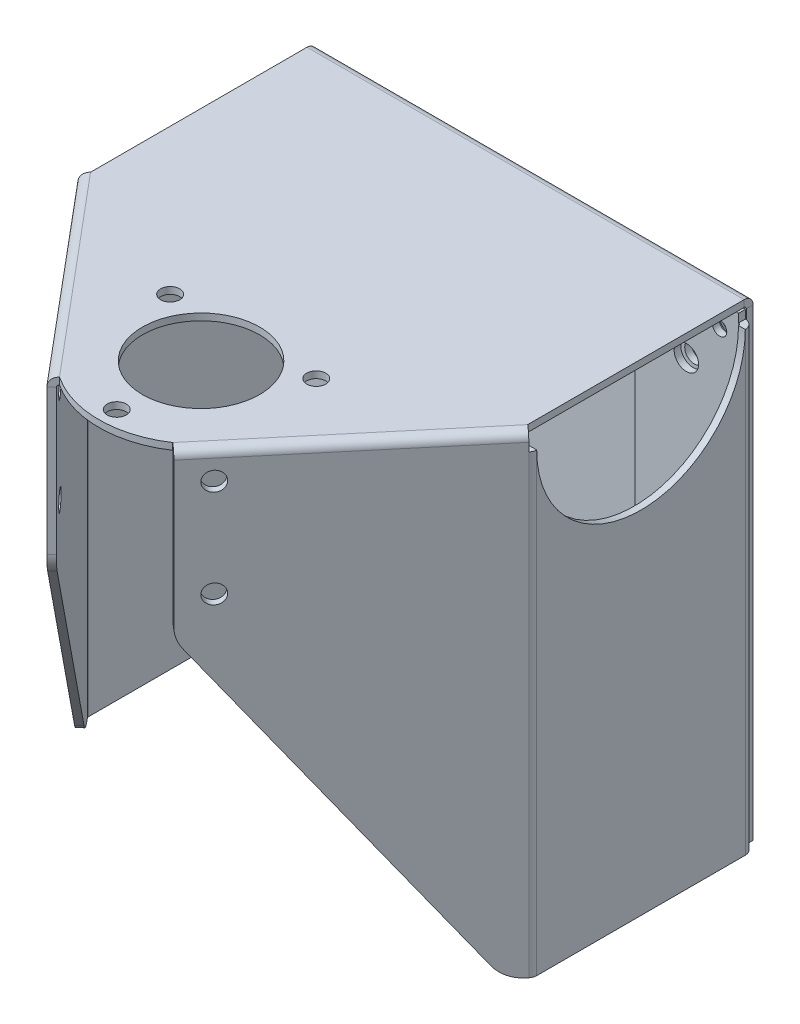
from build123d import *

# Parameters (mm, degrees)
SKETCH1_W                       = 98.5
SKETCH1_H                       = 105
BASE_FLANGE1_DEPTH              = 1.524
EDGE_FLANGE11_STRIP_W           = 7.096
EDGE_FLANGE11_STRIP_H           = 1.524
EDGE_FLANGE11_STRIP_CUT_DEPTH   = 98.5
EDGE_FLANGE11_DEPTH             = 98.5
CUT_EXTRUDE5_DEPTH              = 126.105066452
CUT_EXTRUDE5_DEPTH_BACK         = 126.105066452
SKETCH21_OUTSIDE_W              = 135.916
SKETCH21_OUTSIDE_H              = 138.94
EDGE_FLANGE12_DEPTH             = 56.768812786
EDGE_FLANGE12_BEND_DEPTH        = 56.768812786
EDGE_FLANGE13_DEPTH             = 104.5
EDGE_FLANGE13_BEND_DEPTH        = 104.5
EDGE_FLANGE14_STRIP_W           = 7.346
EDGE_FLANGE14_STRIP_H           = 1.524
EDGE_FLANGE14_STRIP_CUT_DEPTH   = 104.5
EDGE_FLANGE14_STRIP_2_W         = 7.346
EDGE_FLANGE14_STRIP_2_H         = 1.524
EDGE_FLANGE14_STRIP_CUT_2_DEPTH = 104.5
EDGE_FLANGE14_DEPTH             = 104.5
EDGE_FLANGE14_BEND_DEPTH        = 104.5
M4_CLEARANCE_HOLE4_D            = 5.5
M4_CLEARANCE_HOLE4_DEPTH        = 1.773
M4_CLEARANCE_HOLE7_REACH        = 125.212
M4_CLEARANCE_HOLE7_BORE_R       = 2.15
SKETCH54_R                      = 13.2
CUT_EXTRUDE3_DEPTH              = 154.655695253
UNFOLD1_START                   = -52.5
UNFOLD1_DEPTH                   = 104.5
UNFOLD1_2_DEPTH                 = 104.5
UNFOLD1_START_2                 = 70
UNFOLD1_3_OUTLINE_R             = 2.75
UNFOLD1_3_OUTLINE_R_2           = 1.6
UNFOLD1_3_DEPTH                 = 3
CUT_EXTRUDE8_REACH              = 132.29
UNFOLD2_START                   = -52.5
UNFOLD2_DEPTH                   = 104.5
UNFOLD2_2_DEPTH                 = 104.5
UNFOLD2_START_2                 = -73
UNFOLD2_3_OUTLINE_R             = 2.75
UNFOLD2_3_OUTLINE_R_2           = 1.6
UNFOLD2_3_DEPTH                 = 3
CUT_EXTRUDE9_REACH              = 172.578
FOLD8_START                     = 50.619283571
FOLD8_OUTLINE_W                 = 1.524
FOLD8_OUTLINE_H                 = 102.601
FOLD8_DEPTH                     = 1.481718551
FOLD8_START_2                   = 50.446476318
FOLD8_2_OUTLINE_W               = 1.524
FOLD8_2_OUTLINE_H               = 102.601
FOLD8_2_DEPTH                   = 0.353523682
FOLD8_START_3                   = -52.5
FOLD8_3_DEPTH                   = 104.5
FOLD8_START_4                   = 48.6000001
FOLD8_4_DEPTH                   = 1.5009999
FOLD8_5_DEPTH                   = 102.601
FOLD8_START_5                   = 50.101
FOLD8_6_OUTLINE_W               = 23.376
FOLD8_6_OUTLINE_H               = 1.524
FOLD8_6_DEPTH                   = 1.899
FOLD8_START_6                   = 40.12202674
FOLD8_7_DEPTH                   = 8.47797336
M4_CLEARANCE_HOLE5_D            = 4.3
M4_CLEARANCE_HOLE5_DEPTH        = 29.478592313
FILLET2_R                       = 7
M4_CLEARANCE_HOLE6_D            = 4.3


with BuildPart() as part:
    # Base-Flange1: sheet metal written as solids
    # Sketch1 → Base-Flange1 (new body)
    with BuildSketch(Plane.XY):
        Rectangle(SKETCH1_W, SKETCH1_H)
    extrude(amount=BASE_FLANGE1_DEPTH)

    # Edge-Flange11: sheet metal written as solids
    # Edge-Flange11 strip (on a plane across the edge) → Edge-Flange11 strip cut (cut)
    with BuildSketch(Plane(origin=(49.25, 52.5, 1.524), x_dir=(0, -1, 0), z_dir=(-1, 0, 0))):
        with Locations((-3.048, -0.762)):
            Rectangle(EDGE_FLANGE11_STRIP_W, EDGE_FLANGE11_STRIP_H)
    extrude(amount=EDGE_FLANGE11_STRIP_CUT_DEPTH, mode=Mode.SUBTRACT)

    # Edge-Flange11 section (on a plane across the edge) → Edge-Flange11 (add)
    with BuildSketch(Plane(origin=(49.25, 52.5, 1.524), x_dir=(0, -1, 0), z_dir=(-1, 0, 0))):
        with BuildLine():
            Line((-1.524, 0.5), (-1.524, 100))
            Line((-1.524, 100), (0, 100))
            Line((0, 100), (0, 0.5))
            ThreePointArc((0, 0.5), (0.146446609, 0.146446609), (0.5, 0))
            Line((0.5, 0), (0.5, -1.524))
            ThreePointArc((0.5, -1.524), (-0.931184125, -0.931184125), (-1.524, 0.5))
        make_face()
    extrude(amount=EDGE_FLANGE11_DEPTH)

    # Sketch21 outside → Cut-Extrude5 (cut, two sides: drawn at the far end of the back side and taken through both)
    with BuildSketch(Plane(origin=(0, 0, 0), x_dir=(1, 0, 0), z_dir=(0, 1, 0)).offset(-CUT_EXTRUDE5_DEPTH_BACK)):
        with Locations((0, -50.762)):
            Rectangle(SKETCH21_OUTSIDE_W, SKETCH21_OUTSIDE_H)
        with BuildLine():
            Line((49.25, 0), (0, 0))
            Line((0, 0), (-49.25, 0))
            Line((-49.25, 0), (-49.25, -50.8))
            Line((-49.25, -50.8), (-12.759710524, -94.287433577))
            ThreePointArc((-12.759710524, -94.287433577), (0, -98.151347579), (12.759710524, -94.287433577))
            Line((12.759710524, -94.287433577), (16.910388429, -89.340848273))
            Line((16.910388429, -89.340848273), (49.25, -50.8))
            Line((49.25, -50.8), (49.25, 0))
        make_face(mode=Mode.SUBTRACT)
    extrude(amount=CUT_EXTRUDE5_DEPTH + CUT_EXTRUDE5_DEPTH_BACK, mode=Mode.SUBTRACT)

    # Edge-Flange12: sheet metal written as solids
    # Edge-Flange12 section (on a plane across the edge) → Edge-Flange12 (add)
    with BuildSketch(Plane(origin=(-13.142732746, 52.5, 94.608827382), x_dir=(0.7660444431189775, -5.72159885202365e-15, -0.64278760968654), z_dir=(-0.64278760968654, -2.566845506020086e-15, -0.7660444431189775))):
        with BuildLine():
            Line((-1.524, 0.5), (-1.524, 105))
            Line((-1.524, 105), (0, 105))
            Line((0, 105), (0, 0.5))
            ThreePointArc((0, 0.5), (0.146446609, 0.146446609), (0.5, 0))
            Line((0.5, 0), (0.5, -1.524))
            ThreePointArc((0.5, -1.524), (-0.931184125, -0.931184125), (-1.524, 0.5))
        make_face()
    extrude(amount=EDGE_FLANGE12_DEPTH)

    # Edge-Flange12 section 2 (on a plane across the edge) → Edge-Flange12 bend (add)
    with BuildSketch(Plane(origin=(49.633022222, 52.5, 51.121393805), x_dir=(-0.7660444431189778, -5.721598852023648e-15, -0.6427876096865397), z_dir=(-0.6427876096865397, 2.689076244401993e-15, 0.7660444431189778))):
        with BuildLine():
            Line((-1.524, 0.5), (-1.524, 105))
            Line((-1.524, 105), (0, 105))
            Line((0, 105), (0, 0.5))
            ThreePointArc((0, 0.5), (0.146446609, 0.146446609), (0.5, 0))
            Line((0.5, 0), (0.5, -1.524))
            ThreePointArc((0.5, -1.524), (-0.931184125, -0.931184125), (-1.524, 0.5))
        make_face()
    extrude(amount=EDGE_FLANGE12_BEND_DEPTH)

    # Edge-Flange13: sheet metal written as solids
    # Edge-Flange13 section (on a plane across the edge) → Edge-Flange13 (add)
    with BuildSketch(Plane(origin=(-49.75, -52.5, 50.981985117), x_dir=(1, 0, 0), z_dir=(0, 1, 0))):
        with BuildLine():
            Line((-1.524, 0.181985117), (-1.524, 49.457985117))
            Line((-1.524, 49.457985117), (0, 49.457985117))
            Line((0, 49.457985117), (0, 0.181985117))
            ThreePointArc((0, 0.181985117), (0.03015369, 0.010975045), (0.116977778, -0.139408688))
            Line((0.116977778, -0.139408688), (-1.050473953, -1.119017005))
            ThreePointArc((-1.050473953, -1.119017005), (-1.401937864, -0.510263653), (-1.524, 0.181985117))
        make_face()
    extrude(amount=EDGE_FLANGE13_DEPTH)

    # Edge-Flange13 section 2 (on a plane across the edge) → Edge-Flange13 bend (add)
    with BuildSketch(Plane(origin=(49.75, 52, 50.981985117), x_dir=(-1, 0, 0), z_dir=(0, -1, 0))):
        with BuildLine():
            Line((-1.524, 0.181985117), (-1.524, 49.457985117))
            Line((-1.524, 49.457985117), (0, 49.457985117))
            Line((0, 49.457985117), (0, 0.181985117))
            ThreePointArc((0, 0.181985117), (0.03015369, 0.010975045), (0.116977778, -0.139408688))
            Line((0.116977778, -0.139408688), (-1.050473953, -1.119017005))
            ThreePointArc((-1.050473953, -1.119017005), (-1.401937864, -0.510263653), (-1.524, 0.181985117))
        make_face()
    extrude(amount=EDGE_FLANGE13_BEND_DEPTH)

    # Edge-Flange14: sheet metal written as solids
    # Edge-Flange14 strip (on a plane across the edge) → Edge-Flange14 strip cut (cut)
    with BuildSketch(Plane(origin=(-49.75, -52.5, 1.774), x_dir=(0, 0, 1), z_dir=(0, 1, 0))):
        with Locations((-1.649, -0.762)):
            Rectangle(EDGE_FLANGE14_STRIP_W, EDGE_FLANGE14_STRIP_H)
    extrude(amount=EDGE_FLANGE14_STRIP_CUT_DEPTH, mode=Mode.SUBTRACT)

    # Edge-Flange14 strip 2 (on a plane across the edge) → Edge-Flange14 strip cut 2 (cut)
    with BuildSketch(Plane(origin=(49.75, 52, 1.774), x_dir=(0, 0, 1), z_dir=(0, -1, 0))):
        with Locations((-1.649, -0.762)):
            Rectangle(EDGE_FLANGE14_STRIP_2_W, EDGE_FLANGE14_STRIP_2_H)
    extrude(amount=EDGE_FLANGE14_STRIP_CUT_2_DEPTH, mode=Mode.SUBTRACT)

    # Edge-Flange14 section (on a plane across the edge) → Edge-Flange14 (add)
    with BuildSketch(Plane(origin=(-49.75, -52.5, 1.774), x_dir=(0, 0, 1), z_dir=(0, 1, 0))):
        with BuildLine():
            Line((0, 0.5), (0, 23.876))
            Line((0, 23.876), (1.524, 23.876))
            Line((1.524, 23.876), (1.524, 0.5))
            ThreePointArc((1.524, 0.5), (1.670446609, 0.146446609), (2.024, 0))
            Line((2.024, 0), (2.024, -1.524))
            ThreePointArc((2.024, -1.524), (0.592815875, -0.931184125), (0, 0.5))
        make_face()
    extrude(amount=EDGE_FLANGE14_DEPTH)

    # Edge-Flange14 section 2 (on a plane across the edge) → Edge-Flange14 bend (add)
    with BuildSketch(Plane(origin=(49.75, 52, 1.774), x_dir=(0, 0, 1), z_dir=(0, -1, 0))):
        with BuildLine():
            Line((0, 0.5), (0, 23.876))
            Line((0, 23.876), (1.524, 23.876))
            Line((1.524, 23.876), (1.524, 0.5))
            ThreePointArc((1.524, 0.5), (1.670446609, 0.146446609), (2.024, 0))
            Line((2.024, 0), (2.024, -1.524))
            ThreePointArc((2.024, -1.524), (0.592815875, -0.931184125), (0, 0.5))
        make_face()
    extrude(amount=EDGE_FLANGE14_BEND_DEPTH)

    # M4 Clearance Hole4
    with Locations(Plane.XY.offset(3.298)):
        with Locations((37.5, 37.5), (-37.5, -37.5), (-37.5, 37.5), (37.5, -37.5)):
            Hole(M4_CLEARANCE_HOLE4_D / 2, depth=M4_CLEARANCE_HOLE4_DEPTH)

    # M4 Clearance Hole7 bore → M4 Clearance Hole7 (cut, up to next)
    with BuildSketch(Plane(origin=(0, 0, 0), x_dir=(-1, 0, 0), z_dir=(0, 0, -1)), mode=Mode.PRIVATE) as m4_clearance_hole7_sk1:
        with Locations((-37.5, 37.5)):
            Circle(M4_CLEARANCE_HOLE7_BORE_R)
    m4_clearance_hole7_tool1 = extrude(m4_clearance_hole7_sk1.sketch, amount=-M4_CLEARANCE_HOLE7_REACH, mode=Mode.PRIVATE) & part.part
    # M4 Clearance Hole7 bore → M4 Clearance Hole7 (cut, up to next)
    with BuildSketch(Plane(origin=(0, 0, 0), x_dir=(-1, 0, 0), z_dir=(0, 0, -1)), mode=Mode.PRIVATE) as m4_clearance_hole7_sk2:
        with Locations((-37.5, -37.5)):
            Circle(M4_CLEARANCE_HOLE7_BORE_R)
    m4_clearance_hole7_tool2 = extrude(m4_clearance_hole7_sk2.sketch, amount=-M4_CLEARANCE_HOLE7_REACH, mode=Mode.PRIVATE) & part.part
    # M4 Clearance Hole7 bore → M4 Clearance Hole7 (cut, up to next)
    with BuildSketch(Plane(origin=(0, 0, 0), x_dir=(-1, 0, 0), z_dir=(0, 0, -1)), mode=Mode.PRIVATE) as m4_clearance_hole7_sk3:
        with Locations((37.5, -37.5)):
            Circle(M4_CLEARANCE_HOLE7_BORE_R)
    m4_clearance_hole7_tool3 = extrude(m4_clearance_hole7_sk3.sketch, amount=-M4_CLEARANCE_HOLE7_REACH, mode=Mode.PRIVATE) & part.part
    # M4 Clearance Hole7 bore → M4 Clearance Hole7 (cut, up to next)
    with BuildSketch(Plane(origin=(0, 0, 0), x_dir=(-1, 0, 0), z_dir=(0, 0, -1)), mode=Mode.PRIVATE) as m4_clearance_hole7_sk4:
        with Locations((37.5, 37.5)):
            Circle(M4_CLEARANCE_HOLE7_BORE_R)
    m4_clearance_hole7_tool4 = extrude(m4_clearance_hole7_sk4.sketch, amount=-M4_CLEARANCE_HOLE7_REACH, mode=Mode.PRIVATE) & part.part
    add(m4_clearance_hole7_tool1.solids().sort_by_distance((37.5, 37.5, 0))[0], mode=Mode.SUBTRACT)
    add(m4_clearance_hole7_tool2.solids().sort_by_distance((37.5, -37.5, 0))[0], mode=Mode.SUBTRACT)
    add(m4_clearance_hole7_tool3.solids().sort_by_distance((-37.5, -37.5, 0))[0], mode=Mode.SUBTRACT)
    add(m4_clearance_hole7_tool4.solids().sort_by_distance((-37.5, 37.5, 0))[0], mode=Mode.SUBTRACT)

    # Sketch54 → Cut-Extrude3 (cut, through all)
    with BuildSketch(Plane(origin=(0, 54.024, 0), x_dir=(1, 0, 0), z_dir=(0, 1, 0))):
        with Locations(Location((0, -75.151347579, 0), (0, 0, 270))):
            Circle(SKETCH54_R)
    extrude(amount=-CUT_EXTRUDE3_DEPTH, mode=Mode.SUBTRACT)

    # CSK for M3 Countersunk Flat Head Screw1: read off the stored shape, not the designer's step
    # CSK for M3 Countersunk Flat Head Screw1: loft between two sections, ruled curve by curve
    csk_for_m3_countersunk_flat_head_screw1_from = [
        Edge.make_three_point_arc((-43.4, -47, 3.298), (-45, -48.6, 3.298), (-46.6, -47, 3.298)),
        Edge.make_three_point_arc((-46.6, -47, 3.298), (-45, -45.4, 3.298), (-43.4, -47, 3.298)),
    ]
    csk_for_m3_countersunk_flat_head_screw1_to = [
        Edge.make_three_point_arc((-43.4, -47, 1.774), (-45, -48.6, 1.774), (-46.6, -47, 1.774)),
        Edge.make_three_point_arc((-46.6, -47, 1.774), (-45, -45.4, 1.774), (-43.4, -47, 1.774)),
    ]
    csk_for_m3_countersunk_flat_head_screw1 = Solid(Shell([*[Face.make_surface_from_curves(csk_for_m3_countersunk_flat_head_screw1_from[k], csk_for_m3_countersunk_flat_head_screw1_to[k]) for k in range(2)], Face(Wire(csk_for_m3_countersunk_flat_head_screw1_from)), Face(Wire(csk_for_m3_countersunk_flat_head_screw1_to))]))
    add(csk_for_m3_countersunk_flat_head_screw1, mode=Mode.SUBTRACT)

    # CSK for M3 Countersunk Flat Head Scr 2: loft between two sections, ruled curve by curve
    csk_for_m3_countersunk_flat_head_scr_2_from = [
        Edge.make_three_point_arc((-46.626, -47, 1.524), (-45, -45.374, 1.524), (-43.374, -47, 1.524)),
        Edge.make_three_point_arc((-43.374, -47, 1.524), (-45, -48.626, 1.524), (-46.626, -47, 1.524)),
    ]
    csk_for_m3_countersunk_flat_head_scr_2_to = [
        Edge.make_three_point_arc((-48.15, -47, 0), (-45, -43.85, 0), (-41.85, -47, 0)),
        Edge.make_three_point_arc((-41.85, -47, 0), (-45, -50.15, 0), (-48.15, -47, 0)),
    ]
    csk_for_m3_countersunk_flat_head_scr_2 = Solid(Shell([*[Face.make_surface_from_curves(csk_for_m3_countersunk_flat_head_scr_2_from[k], csk_for_m3_countersunk_flat_head_scr_2_to[k]) for k in range(2)], Face(Wire(csk_for_m3_countersunk_flat_head_scr_2_from)), Face(Wire(csk_for_m3_countersunk_flat_head_scr_2_to))]))
    add(csk_for_m3_countersunk_flat_head_scr_2, mode=Mode.SUBTRACT)

    # CSK for M3 Countersunk Flat Head Scr 3: loft between two sections, ruled curve by curve
    csk_for_m3_countersunk_flat_head_scr_3_from = [
        Edge.make_three_point_arc((43.4, -47, 3.298), (45, -45.4, 3.298), (46.6, -47, 3.298)),
        Edge.make_three_point_arc((46.6, -47, 3.298), (45, -48.6, 3.298), (43.4, -47, 3.298)),
    ]
    csk_for_m3_countersunk_flat_head_scr_3_to = [
        Edge.make_three_point_arc((43.4, -47, 1.774), (45, -45.4, 1.774), (46.6, -47, 1.774)),
        Edge.make_three_point_arc((46.6, -47, 1.774), (45, -48.6, 1.774), (43.4, -47, 1.774)),
    ]
    csk_for_m3_countersunk_flat_head_scr_3 = Solid(Shell([*[Face.make_surface_from_curves(csk_for_m3_countersunk_flat_head_scr_3_from[k], csk_for_m3_countersunk_flat_head_scr_3_to[k]) for k in range(2)], Face(Wire(csk_for_m3_countersunk_flat_head_scr_3_from)), Face(Wire(csk_for_m3_countersunk_flat_head_scr_3_to))]))
    add(csk_for_m3_countersunk_flat_head_scr_3, mode=Mode.SUBTRACT)

    # CSK for M3 Countersunk Flat Head Scr 4: loft between two sections, ruled curve by curve
    csk_for_m3_countersunk_flat_head_scr_4_from = [
        Edge.make_three_point_arc((43.374, -47, 1.524), (45, -45.374, 1.524), (46.626, -47, 1.524)),
        Edge.make_three_point_arc((46.626, -47, 1.524), (45, -48.626, 1.524), (43.374, -47, 1.524)),
    ]
    csk_for_m3_countersunk_flat_head_scr_4_to = [
        Edge.make_three_point_arc((41.85, -47, 0), (45, -43.85, 0), (48.15, -47, 0)),
        Edge.make_three_point_arc((48.15, -47, 0), (45, -50.15, 0), (41.85, -47, 0)),
    ]
    csk_for_m3_countersunk_flat_head_scr_4 = Solid(Shell([*[Face.make_surface_from_curves(csk_for_m3_countersunk_flat_head_scr_4_from[k], csk_for_m3_countersunk_flat_head_scr_4_to[k]) for k in range(2)], Face(Wire(csk_for_m3_countersunk_flat_head_scr_4_from)), Face(Wire(csk_for_m3_countersunk_flat_head_scr_4_to))]))
    add(csk_for_m3_countersunk_flat_head_scr_4, mode=Mode.SUBTRACT)

    # CSK for M3 Countersunk Flat Head Scr 5: loft between two sections, ruled curve by curve
    csk_for_m3_countersunk_flat_head_scr_5_from = [
        Edge.make_three_point_arc((43.4, 47, 3.298), (45, 48.6, 3.298), (46.6, 47, 3.298)),
        Edge.make_three_point_arc((46.6, 47, 3.298), (45, 45.4, 3.298), (43.4, 47, 3.298)),
    ]
    csk_for_m3_countersunk_flat_head_scr_5_to = [
        Edge.make_three_point_arc((43.4, 47, 1.774), (45, 48.6, 1.774), (46.6, 47, 1.774)),
        Edge.make_three_point_arc((46.6, 47, 1.774), (45, 45.4, 1.774), (43.4, 47, 1.774)),
    ]
    csk_for_m3_countersunk_flat_head_scr_5 = Solid(Shell([*[Face.make_surface_from_curves(csk_for_m3_countersunk_flat_head_scr_5_from[k], csk_for_m3_countersunk_flat_head_scr_5_to[k]) for k in range(2)], Face(Wire(csk_for_m3_countersunk_flat_head_scr_5_from)), Face(Wire(csk_for_m3_countersunk_flat_head_scr_5_to))]))
    add(csk_for_m3_countersunk_flat_head_scr_5, mode=Mode.SUBTRACT)

    # CSK for M3 Countersunk Flat Head Scr 6: loft between two sections, ruled curve by curve
    csk_for_m3_countersunk_flat_head_scr_6_from = [
        Edge.make_three_point_arc((43.374, 47, 1.524), (45, 48.626, 1.524), (46.626, 47, 1.524)),
        Edge.make_three_point_arc((46.626, 47, 1.524), (45, 45.374, 1.524), (43.374, 47, 1.524)),
    ]
    csk_for_m3_countersunk_flat_head_scr_6_to = [
        Edge.make_three_point_arc((41.85, 47, 0), (45, 50.15, 0), (48.15, 47, 0)),
        Edge.make_three_point_arc((48.15, 47, 0), (45, 43.85, 0), (41.85, 47, 0)),
    ]
    csk_for_m3_countersunk_flat_head_scr_6 = Solid(Shell([*[Face.make_surface_from_curves(csk_for_m3_countersunk_flat_head_scr_6_from[k], csk_for_m3_countersunk_flat_head_scr_6_to[k]) for k in range(2)], Face(Wire(csk_for_m3_countersunk_flat_head_scr_6_from)), Face(Wire(csk_for_m3_countersunk_flat_head_scr_6_to))]))
    add(csk_for_m3_countersunk_flat_head_scr_6, mode=Mode.SUBTRACT)

    # CSK for M3 Countersunk Flat Head Scr 7: loft between two sections, ruled curve by curve
    csk_for_m3_countersunk_flat_head_scr_7_from = [
        Edge.make_three_point_arc((-46.626, 47, 1.524), (-45, 48.626, 1.524), (-43.374, 47, 1.524)),
        Edge.make_three_point_arc((-43.374, 47, 1.524), (-45, 45.374, 1.524), (-46.626, 47, 1.524)),
    ]
    csk_for_m3_countersunk_flat_head_scr_7_to = [
        Edge.make_three_point_arc((-48.15, 47, 0), (-45, 50.15, 0), (-41.85, 47, 0)),
        Edge.make_three_point_arc((-41.85, 47, 0), (-45, 43.85, 0), (-48.15, 47, 0)),
    ]
    csk_for_m3_countersunk_flat_head_scr_7 = Solid(Shell([*[Face.make_surface_from_curves(csk_for_m3_countersunk_flat_head_scr_7_from[k], csk_for_m3_countersunk_flat_head_scr_7_to[k]) for k in range(2)], Face(Wire(csk_for_m3_countersunk_flat_head_scr_7_from)), Face(Wire(csk_for_m3_countersunk_flat_head_scr_7_to))]))
    add(csk_for_m3_countersunk_flat_head_scr_7, mode=Mode.SUBTRACT)

    # CSK for M3 Countersunk Flat Head Scr 8: loft between two sections, ruled curve by curve
    csk_for_m3_countersunk_flat_head_scr_8_from = [
        Edge.make_three_point_arc((-43.4, 47, 3.298), (-45, 45.4, 3.298), (-46.6, 47, 3.298)),
        Edge.make_three_point_arc((-46.6, 47, 3.298), (-45, 48.6, 3.298), (-43.4, 47, 3.298)),
    ]
    csk_for_m3_countersunk_flat_head_scr_8_to = [
        Edge.make_three_point_arc((-43.4, 47, 1.774), (-45, 45.4, 1.774), (-46.6, 47, 1.774)),
        Edge.make_three_point_arc((-46.6, 47, 1.774), (-45, 48.6, 1.774), (-43.4, 47, 1.774)),
    ]
    csk_for_m3_countersunk_flat_head_scr_8 = Solid(Shell([*[Face.make_surface_from_curves(csk_for_m3_countersunk_flat_head_scr_8_from[k], csk_for_m3_countersunk_flat_head_scr_8_to[k]) for k in range(2)], Face(Wire(csk_for_m3_countersunk_flat_head_scr_8_from)), Face(Wire(csk_for_m3_countersunk_flat_head_scr_8_to))]))
    add(csk_for_m3_countersunk_flat_head_scr_8, mode=Mode.SUBTRACT)

    # Unfold1: read off the stored shape, not the designer's step
    # Unfold1 outline → Unfold1 (cut)
    with BuildSketch(Plane(origin=(0, 0, 0), x_dir=(1, 0, 0), z_dir=(0, 1, 0)).offset(UNFOLD1_START)):
        with BuildLine():
            Line((50.199345235, -50.446476318), (51.274, -49.165752641))
            Line((51.274, -49.165752641), (51.274, -3.798))
            ThreePointArc((51.274, -3.798), (50.681184125, -2.366815875), (49.25, -1.774))
            Line((49.25, -1.774), (25.874, -1.774))
            Line((25.874, -1.774), (25.874, -3.298))
            Line((25.874, -3.298), (49.25, -3.298))
            ThreePointArc((49.25, -3.298), (49.603553391, -3.444446609), (49.75, -3.798))
            Line((49.75, -3.798), (49.75, -50.8))
            ThreePointArc((49.75, -50.8), (49.71984631, -50.971010072), (49.633022222, -51.121393805))
            Line((49.633022222, -51.121393805), (50.199345235, -50.446476318))
        make_face()
    extrude(amount=UNFOLD1_DEPTH, mode=Mode.SUBTRACT)

    # Unfold1 2 outline → Unfold1 2 (add)
    with BuildSketch(Plane(origin=(0, 0, 0), x_dir=(1, 0, 0), z_dir=(0, 1, 0)).offset(UNFOLD1_START)):
        with BuildLine():
            Line((50.800473953, -52.101002122), (51.366796967, -51.426084636))
            Line((51.366796967, -51.426084636), (81.579100197, -15.42046372))
            Line((81.579100197, -15.42046372), (82.853326978, -13.901899376))
            Line((82.853326978, -13.901899376), (97.879130143, 4.005155527))
            Line((97.879130143, 4.005155527), (96.711678411, 4.984763844))
            Line((96.711678411, 4.984763844), (81.685875247, -12.922291059))
            Line((81.685875247, -12.922291059), (80.411648466, -14.440855403))
            Line((80.411648466, -14.440855403), (51.274, -49.165752641))
            Line((51.274, -49.165752641), (51.274, -50.8))
            ThreePointArc((51.274, -50.8), (51.151937864, -51.49224877), (50.800473953, -52.101002122))
        make_face()
    extrude(amount=UNFOLD1_2_DEPTH)

    # Unfold1 3 outline → Unfold1 3 (cut)
    with BuildSketch(Plane(origin=(0, 0, 0), x_dir=(0.6427876096865404, 0, -0.7660444431189772), z_dir=(0.7660444431189772, 0, 0.6427876096865403)).offset(UNFOLD1_START_2)):
        with Locations((54.357619237, -37.5)):
            Circle(UNFOLD1_3_OUTLINE_R)
        with Locations((54.357619237, 37.5)):
            Circle(UNFOLD1_3_OUTLINE_R)
        with Locations((46.857619237, -47)):
            Circle(UNFOLD1_3_OUTLINE_R_2)
        with Locations((46.857619237, 47)):
            Circle(UNFOLD1_3_OUTLINE_R_2)
    extrude(amount=UNFOLD1_3_DEPTH, mode=Mode.SUBTRACT)

    # Sketch92 → Cut-Extrude8 (cut, up to next)
    with BuildSketch(Plane(origin=(55.465677254, 0, 46.541229327), x_dir=(0.6427876096865401, 4.8138028969691835e-15, -0.7660444431189773), z_dir=(0.7660444431189773, 5.736866896503428e-15, 0.6427876096865401)), mode=Mode.PRIVATE) as cut_extrude8_sk1:
        Polygon((-11.257767933, -52.5), (-64.026580719, 17), (-64.026580719, -52.5), align=None)
    cut_extrude8_tool1 = extrude(cut_extrude8_sk1.sketch, amount=-CUT_EXTRUDE8_REACH, mode=Mode.PRIVATE) & part.part
    # Sketch92 → Cut-Extrude8 (cut, up to next)
    with BuildSketch(Plane(origin=(55.465677254, 0, 46.541229327), x_dir=(0.6427876096865401, 4.8138028969691835e-15, -0.7660444431189773), z_dir=(0.7660444431189773, 5.736866896503428e-15, 0.6427876096865401)), mode=Mode.PRIVATE) as cut_extrude8_sk2:
        with BuildLine():
            Line((42.607619237, 52), (-7.257767933, 52))
            Line((-7.257767933, 52), (-7.257767933, 50.101))
            Line((-7.257767933, 50.101), (-6.376725727, 50.101))
            ThreePointArc((-6.376725727, 50.101), (17.124274273, 26.6), (40.625274273, 50.101))
            Line((40.625274273, 50.101), (42.607619237, 50.101))
            Line((42.607619237, 50.101), (42.607619237, 52))
        make_face()
    cut_extrude8_tool2 = extrude(cut_extrude8_sk2.sketch, amount=-CUT_EXTRUDE8_REACH, mode=Mode.PRIVATE) & part.part
    add(cut_extrude8_tool1.solids().sort_by_distance((25.616564, -29.333333, 82.114017))[0], mode=Mode.SUBTRACT)
    add(cut_extrude8_tool2.solids().sort_by_distance((66.507781, 41.201864, 33.381762))[0], mode=Mode.SUBTRACT)

    # Unfold2: read off the stored shape, not the designer's step
    # Unfold2 outline → Unfold2 (cut)
    with BuildSketch(Plane(origin=(0, 0, 0), x_dir=(1, 0, 0), z_dir=(0, 1, 0)).offset(UNFOLD2_START)):
        with BuildLine():
            Line((-51.274, -3.798), (-51.274, -49.165752641))
            Line((-51.274, -49.165752641), (-50.199345235, -50.446476318))
            Line((-50.199345235, -50.446476318), (-49.633022222, -51.121393805))
            ThreePointArc((-49.633022222, -51.121393805), (-49.71984631, -50.971010072), (-49.75, -50.8))
            Line((-49.75, -50.8), (-49.75, -3.798))
            ThreePointArc((-49.75, -3.798), (-49.603553391, -3.444446609), (-49.25, -3.298))
            Line((-49.25, -3.298), (-25.874, -3.298))
            Line((-25.874, -3.298), (-25.874, -1.774))
            Line((-25.874, -1.774), (-49.25, -1.774))
            ThreePointArc((-49.25, -1.774), (-50.681184125, -2.366815875), (-51.274, -3.798))
        make_face()
    extrude(amount=UNFOLD2_DEPTH, mode=Mode.SUBTRACT)

    # Unfold2 2 outline → Unfold2 2 (add)
    with BuildSketch(Plane(origin=(0, 0, 0), x_dir=(1, 0, 0), z_dir=(0, 1, 0)).offset(UNFOLD2_START)):
        with BuildLine():
            Line((-51.366796967, -51.426084636), (-50.800473953, -52.101002122))
            ThreePointArc((-50.800473953, -52.101002122), (-51.151937864, -51.49224877), (-51.274, -50.8))
            Line((-51.274, -50.8), (-51.274, -49.165752641))
            Line((-51.274, -49.165752641), (-80.411648466, -14.440855403))
            Line((-80.411648466, -14.440855403), (-81.685875247, -12.922291059))
            Line((-81.685875247, -12.922291059), (-96.711678411, 4.984763844))
            Line((-96.711678411, 4.984763844), (-97.879130143, 4.005155527))
            Line((-97.879130143, 4.005155527), (-82.853326978, -13.901899376))
            Line((-82.853326978, -13.901899376), (-81.579100197, -15.42046372))
            Line((-81.579100197, -15.42046372), (-51.366796967, -51.426084636))
        make_face()
    extrude(amount=UNFOLD2_2_DEPTH)

    # Unfold2 3 outline → Unfold2 3 (cut)
    with BuildSketch(Plane(origin=(0, 0, 0), x_dir=(0.6427876096865404, 0, 0.7660444431189772), z_dir=(0.7660444431189772, 0, -0.6427876096865403)).offset(UNFOLD2_START_2)):
        with Locations((-54.357619237, -37.5)):
            Circle(UNFOLD2_3_OUTLINE_R)
        with Locations((-54.357619237, 37.5)):
            Circle(UNFOLD2_3_OUTLINE_R)
        with Locations((-46.857619237, 47)):
            Circle(UNFOLD2_3_OUTLINE_R_2)
        with Locations((-46.857619237, -47)):
            Circle(UNFOLD2_3_OUTLINE_R_2)
    extrude(amount=UNFOLD2_3_DEPTH, mode=Mode.SUBTRACT)

    # Sketch130 → Cut-Extrude9 (cut, up to next)
    with BuildSketch(Plane(origin=(-55.465677254, 0, 46.541229327), x_dir=(0.6427876096865407, -4.800133307240097e-15, 0.7660444431189769), z_dir=(-0.7660444431189769, 5.7205761138344946e-15, 0.6427876096865407)), mode=Mode.PRIVATE) as cut_extrude9_sk1:
        Polygon((64.026580719, 17), (11.257767933, -52.5), (64.026580719, -52.5), align=None)
    cut_extrude9_tool1 = extrude(cut_extrude9_sk1.sketch, amount=-CUT_EXTRUDE9_REACH, mode=Mode.PRIVATE) & part.part
    # Sketch130 → Cut-Extrude9 (cut, up to next)
    with BuildSketch(Plane(origin=(-55.465677254, 0, 46.541229327), x_dir=(0.6427876096865407, -4.800133307240097e-15, 0.7660444431189769), z_dir=(-0.7660444431189769, 5.7205761138344946e-15, 0.6427876096865407)), mode=Mode.PRIVATE) as cut_extrude9_sk2:
        with BuildLine():
            Line((-40.625274273, 50.101), (-42.607619237, 50.101))
            Line((-42.607619237, 50.101), (-42.607619237, 52))
            Line((-42.607619237, 52), (7.257767933, 52))
            Line((7.257767933, 52), (7.257767933, 50.101))
            Line((7.257767933, 50.101), (6.376725727, 50.101))
            ThreePointArc((6.376725727, 50.101), (-17.124274273, 26.6), (-40.625274273, 50.101))
        make_face()
    cut_extrude9_tool2 = extrude(cut_extrude9_sk2.sketch, amount=-CUT_EXTRUDE9_REACH, mode=Mode.PRIVATE) & part.part
    add(cut_extrude9_tool1.solids().sort_by_distance((-25.616564, -29.333333, 82.114017))[0], mode=Mode.SUBTRACT)
    add(cut_extrude9_tool2.solids().sort_by_distance((-66.507781, 41.201864, 33.381762))[0], mode=Mode.SUBTRACT)

    # Fold8: read off the stored shape, not the designer's step
    # Fold8 outline → Fold8 (cut)
    with BuildSketch(Plane.XY.offset(FOLD8_START)):
        with Locations((50.512, -1.1995)):
            Rectangle(FOLD8_OUTLINE_W, FOLD8_OUTLINE_H)
        with Locations((-50.512, -1.1995)):
            Rectangle(FOLD8_OUTLINE_W, FOLD8_OUTLINE_H)
    extrude(amount=FOLD8_DEPTH, mode=Mode.SUBTRACT)

    # Fold8 2 outline → Fold8 2 (cut)
    with BuildSketch(Plane.XY.offset(FOLD8_START_2)):
        with Locations((50.512, -1.1995)):
            Rectangle(FOLD8_2_OUTLINE_W, FOLD8_2_OUTLINE_H)
    extrude(amount=FOLD8_2_DEPTH, mode=Mode.SUBTRACT)

    # Fold8 3 outline → Fold8 3 (cut)
    with BuildSketch(Plane(origin=(0, 0, 0), x_dir=(1, 0, 0), z_dir=(0, 1, 0)).offset(FOLD8_START_3)):
        Polygon((-51.274, -49.165752642), (-96.711678411, 4.984763844), (-97.879130143, 4.005155527), (-51.274, -51.536675754), align=None)
        Polygon((51.274, -49.165752641), (51.274, -51.536675754), (97.879130143, 4.005155527), (96.711678411, 4.984763844), align=None)
    extrude(amount=FOLD8_3_DEPTH, mode=Mode.SUBTRACT)

    # Fold8 4 outline → Fold8 4 (cut)
    with BuildSketch(Plane(origin=(0, 0, 0), x_dir=(1, 0, 0), z_dir=(0, 1, 0)).offset(FOLD8_START_4)):
        Polygon((-50.054342734, -50.619283571), (-51.274, -49.165752642), (-51.274, -50.619283571), align=None)
    extrude(amount=FOLD8_4_DEPTH, mode=Mode.SUBTRACT)

    # Fold8 5 outline → Fold8 5 (add)
    with BuildSketch(Plane(origin=(0, 0, 0), x_dir=(1, 0, 0), z_dir=(0, 1, 0)).offset(FOLD8_START_3)):
        with BuildLine():
            ThreePointArc((-49.75, -3.798), (-49.603553391, -3.444446609), (-49.25, -3.298))
            Line((-49.25, -3.298), (-25.874, -3.298))
            Line((-25.874, -3.298), (-25.874, -1.774))
            Line((-25.874, -1.774), (-49.25, -1.774))
            ThreePointArc((-49.25, -1.774), (-50.681184125, -2.366815875), (-51.274, -3.798))
            Line((-51.274, -3.798), (-51.274, -49.165752642))
            Line((-51.274, -49.165752642), (-50.054342734, -50.619283571))
            Line((-50.054342734, -50.619283571), (-51.274, -50.619283571))
            Line((-51.274, -50.619283571), (-51.274, -50.8))
            ThreePointArc((-51.274, -50.8), (-51.151937864, -51.49224877), (-50.800473953, -52.101002122))
            Line((-50.800473953, -52.101002122), (-49.75, -52.101002122))
            Line((-49.75, -52.101002122), (-49.75, -50.981985117))
            Line((-49.75, -50.981985117), (-49.633022222, -51.121393805))
            ThreePointArc((-49.633022222, -51.121393805), (-49.71984631, -50.971010072), (-49.75, -50.8))
            Line((-49.75, -50.8), (-49.75, -3.798))
        make_face()
        with BuildLine():
            ThreePointArc((51.274, -3.798), (50.681184125, -2.366815875), (49.25, -1.774))
            Line((49.25, -1.774), (25.874, -1.774))
            Line((25.874, -1.774), (25.874, -3.298))
            Line((25.874, -3.298), (49.25, -3.298))
            ThreePointArc((49.25, -3.298), (49.603553391, -3.444446609), (49.75, -3.798))
            Line((49.75, -3.798), (49.75, -50.8))
            ThreePointArc((49.75, -50.8), (49.71984631, -50.971010072), (49.633022222, -51.121393805))
            Line((49.633022222, -51.121393805), (49.75, -50.981985117))
            Line((49.75, -50.981985117), (49.75, -52.101002122))
            Line((49.75, -52.101002122), (50.800473953, -52.101002122))
            ThreePointArc((50.800473953, -52.101002122), (51.151937864, -51.49224877), (51.274, -50.8))
            Line((51.274, -50.8), (51.274, -50.446476318))
            Line((51.274, -50.446476318), (50.199345235, -50.446476318))
            Line((50.199345235, -50.446476318), (51.274, -49.165752641))
            Line((51.274, -49.165752641), (51.274, -3.798))
        make_face()
    extrude(amount=FOLD8_5_DEPTH)

    # Fold8 6 outline → Fold8 6 (add)
    with BuildSketch(Plane(origin=(0, 0, 0), x_dir=(1, 0, 0), z_dir=(0, 1, 0)).offset(FOLD8_START_5)):
        with Locations((-37.562, -2.536)):
            Rectangle(FOLD8_6_OUTLINE_W, FOLD8_6_OUTLINE_H)
        with Locations((37.562, -2.536)):
            Rectangle(FOLD8_6_OUTLINE_W, FOLD8_6_OUTLINE_H)
    extrude(amount=FOLD8_6_DEPTH)

    # Fold8 7 outline → Fold8 7 (add)
    with BuildSketch(Plane(origin=(0, 0, 0), x_dir=(1, 0, 0), z_dir=(0, 1, 0)).offset(FOLD8_START_6)):
        Polygon((-50.054342734, -50.619283571), (-51.274, -49.165752642), (-51.274, -50.619283571), align=None)
        Polygon((51.274, -50.446476318), (51.274, -49.165752641), (50.199345235, -50.446476318), align=None)
    extrude(amount=FOLD8_7_DEPTH)

    # Fold8 8: loft between two sections, ruled curve by curve
    fold8_8_from = [
        Edge.make_three_point_arc((51.274, 50.101, 3.798), (51.274, 33.483283535, 10.681283535), (51.274, 26.6, 27.299)),
        Edge.make_three_point_arc((51.274, 26.6, 27.299), (51.274, 33.483283535, 43.916716465), (51.274, 50.101, 50.8)),
        Edge.make_line((51.274, 50.101, 50.8), (51.274, 50.101, 3.798)),
    ]
    fold8_8_to = [
        Edge.make_three_point_arc((49.75, 50.101, 3.798), (49.75, 33.483283535, 10.681283535), (49.75, 26.6, 27.299)),
        Edge.make_three_point_arc((49.75, 26.6, 27.299), (49.75, 33.483283535, 43.916716465), (49.75, 50.101, 50.8)),
        Edge.make_line((49.75, 50.101, 50.8), (49.75, 50.101, 3.798)),
    ]
    fold8_8 = Solid(Shell([*[Face.make_surface_from_curves(fold8_8_from[k], fold8_8_to[k]) for k in range(3)], Face(Wire(fold8_8_from)), Face(Wire(fold8_8_to))]))
    add(fold8_8, mode=Mode.SUBTRACT)

    # Fold8 9: loft between two sections, ruled curve by curve
    fold8_9_from = [
        Edge.make_three_point_arc((-51.274, 50.101, 50.8), (-51.274, 33.483283535, 43.916716465), (-51.274, 26.6, 27.299)),
        Edge.make_three_point_arc((-51.274, 26.6, 27.299), (-51.274, 33.483283535, 10.681283535), (-51.274, 50.101, 3.798)),
        Edge.make_line((-51.274, 50.101, 3.798), (-51.274, 50.101, 50.8)),
    ]
    fold8_9_to = [
        Edge.make_three_point_arc((-49.75, 50.101, 50.8), (-49.75, 33.483283535, 43.916716465), (-49.75, 26.6, 27.299)),
        Edge.make_three_point_arc((-49.75, 26.6, 27.299), (-49.75, 33.483283535, 10.681283535), (-49.75, 50.101, 3.798)),
        Edge.make_line((-49.75, 50.101, 3.798), (-49.75, 50.101, 50.8)),
    ]
    fold8_9 = Solid(Shell([*[Face.make_surface_from_curves(fold8_9_from[k], fold8_9_to[k]) for k in range(3)], Face(Wire(fold8_9_from)), Face(Wire(fold8_9_to))]))
    add(fold8_9, mode=Mode.SUBTRACT)

    # Fold8 10: loft between two sections, ruled curve by curve
    fold8_10_from = [
        Edge.make_three_point_arc((40.25, -37.5, 1.774), (37.5, -34.75, 1.774), (34.75, -37.5, 1.774)),
        Edge.make_three_point_arc((34.75, -37.5, 1.774), (37.5, -40.25, 1.774), (40.25, -37.5, 1.774)),
    ]
    fold8_10_to = [
        Edge.make_three_point_arc((40.25, -37.5, 3.298), (37.5, -34.75, 3.298), (34.75, -37.5, 3.298)),
        Edge.make_three_point_arc((34.75, -37.5, 3.298), (37.5, -40.25, 3.298), (40.25, -37.5, 3.298)),
    ]
    fold8_10 = Solid(Shell([*[Face.make_surface_from_curves(fold8_10_from[k], fold8_10_to[k]) for k in range(2)], Face(Wire(fold8_10_from)), Face(Wire(fold8_10_to))]))
    add(fold8_10, mode=Mode.SUBTRACT)

    # Fold8 11: loft between two sections, ruled curve by curve
    fold8_11_from = [
        Edge.make_three_point_arc((40.25, 37.5, 1.774), (37.5, 40.25, 1.774), (34.75, 37.5, 1.774)),
        Edge.make_three_point_arc((34.75, 37.5, 1.774), (37.5, 34.75, 1.774), (40.25, 37.5, 1.774)),
    ]
    fold8_11_to = [
        Edge.make_three_point_arc((40.25, 37.5, 3.298), (37.5, 40.25, 3.298), (34.75, 37.5, 3.298)),
        Edge.make_three_point_arc((34.75, 37.5, 3.298), (37.5, 34.75, 3.298), (40.25, 37.5, 3.298)),
    ]
    fold8_11 = Solid(Shell([*[Face.make_surface_from_curves(fold8_11_from[k], fold8_11_to[k]) for k in range(2)], Face(Wire(fold8_11_from)), Face(Wire(fold8_11_to))]))
    add(fold8_11, mode=Mode.SUBTRACT)

    # Fold8 12: loft between two sections, ruled curve by curve
    fold8_12_from = [
        Edge.make_three_point_arc((43.4, -47, 3.298), (45, -45.4, 3.298), (46.6, -47, 3.298)),
        Edge.make_three_point_arc((46.6, -47, 3.298), (45, -48.6, 3.298), (43.4, -47, 3.298)),
    ]
    fold8_12_to = [
        Edge.make_three_point_arc((43.4, -47, 1.774), (45, -45.4, 1.774), (46.6, -47, 1.774)),
        Edge.make_three_point_arc((46.6, -47, 1.774), (45, -48.6, 1.774), (43.4, -47, 1.774)),
    ]
    fold8_12 = Solid(Shell([*[Face.make_surface_from_curves(fold8_12_from[k], fold8_12_to[k]) for k in range(2)], Face(Wire(fold8_12_from)), Face(Wire(fold8_12_to))]))
    add(fold8_12, mode=Mode.SUBTRACT)

    # Fold8 13: loft between two sections, ruled curve by curve
    fold8_13_from = [
        Edge.make_three_point_arc((43.4, 47, 3.298), (45, 48.6, 3.298), (46.6, 47, 3.298)),
        Edge.make_three_point_arc((46.6, 47, 3.298), (45, 45.4, 3.298), (43.4, 47, 3.298)),
    ]
    fold8_13_to = [
        Edge.make_three_point_arc((43.4, 47, 1.774), (45, 48.6, 1.774), (46.6, 47, 1.774)),
        Edge.make_three_point_arc((46.6, 47, 1.774), (45, 45.4, 1.774), (43.4, 47, 1.774)),
    ]
    fold8_13 = Solid(Shell([*[Face.make_surface_from_curves(fold8_13_from[k], fold8_13_to[k]) for k in range(2)], Face(Wire(fold8_13_from)), Face(Wire(fold8_13_to))]))
    add(fold8_13, mode=Mode.SUBTRACT)

    # Fold8 14: loft between two sections, ruled curve by curve
    fold8_14_from = [
        Edge.make_three_point_arc((-34.75, 37.5, 1.774), (-37.5, 40.25, 1.774), (-40.25, 37.5, 1.774)),
        Edge.make_three_point_arc((-40.25, 37.5, 1.774), (-37.5, 34.75, 1.774), (-34.75, 37.5, 1.774)),
    ]
    fold8_14_to = [
        Edge.make_three_point_arc((-34.75, 37.5, 3.298), (-37.5, 40.25, 3.298), (-40.25, 37.5, 3.298)),
        Edge.make_three_point_arc((-40.25, 37.5, 3.298), (-37.5, 34.75, 3.298), (-34.75, 37.5, 3.298)),
    ]
    fold8_14 = Solid(Shell([*[Face.make_surface_from_curves(fold8_14_from[k], fold8_14_to[k]) for k in range(2)], Face(Wire(fold8_14_from)), Face(Wire(fold8_14_to))]))
    add(fold8_14, mode=Mode.SUBTRACT)

    # Fold8 15: loft between two sections, ruled curve by curve
    fold8_15_from = [
        Edge.make_three_point_arc((-34.75, -37.5, 1.774), (-37.5, -34.75, 1.774), (-40.25, -37.5, 1.774)),
        Edge.make_three_point_arc((-40.25, -37.5, 1.774), (-37.5, -40.25, 1.774), (-34.75, -37.5, 1.774)),
    ]
    fold8_15_to = [
        Edge.make_three_point_arc((-34.75, -37.5, 3.298), (-37.5, -34.75, 3.298), (-40.25, -37.5, 3.298)),
        Edge.make_three_point_arc((-40.25, -37.5, 3.298), (-37.5, -40.25, 3.298), (-34.75, -37.5, 3.298)),
    ]
    fold8_15 = Solid(Shell([*[Face.make_surface_from_curves(fold8_15_from[k], fold8_15_to[k]) for k in range(2)], Face(Wire(fold8_15_from)), Face(Wire(fold8_15_to))]))
    add(fold8_15, mode=Mode.SUBTRACT)

    # Fold8 16: loft between two sections, ruled curve by curve
    fold8_16_from = [
        Edge.make_three_point_arc((-43.4, -47, 3.298), (-45, -48.6, 3.298), (-46.6, -47, 3.298)),
        Edge.make_three_point_arc((-46.6, -47, 3.298), (-45, -45.4, 3.298), (-43.4, -47, 3.298)),
    ]
    fold8_16_to = [
        Edge.make_three_point_arc((-43.4, -47, 1.774), (-45, -48.6, 1.774), (-46.6, -47, 1.774)),
        Edge.make_three_point_arc((-46.6, -47, 1.774), (-45, -45.4, 1.774), (-43.4, -47, 1.774)),
    ]
    fold8_16 = Solid(Shell([*[Face.make_surface_from_curves(fold8_16_from[k], fold8_16_to[k]) for k in range(2)], Face(Wire(fold8_16_from)), Face(Wire(fold8_16_to))]))
    add(fold8_16, mode=Mode.SUBTRACT)

    # Fold8 17: loft between two sections, ruled curve by curve
    fold8_17_from = [
        Edge.make_three_point_arc((-43.4, 47, 3.298), (-45, 45.4, 3.298), (-46.6, 47, 3.298)),
        Edge.make_three_point_arc((-46.6, 47, 3.298), (-45, 48.6, 3.298), (-43.4, 47, 3.298)),
    ]
    fold8_17_to = [
        Edge.make_three_point_arc((-43.4, 47, 1.774), (-45, 45.4, 1.774), (-46.6, 47, 1.774)),
        Edge.make_three_point_arc((-46.6, 47, 1.774), (-45, 48.6, 1.774), (-43.4, 47, 1.774)),
    ]
    fold8_17 = Solid(Shell([*[Face.make_surface_from_curves(fold8_17_from[k], fold8_17_to[k]) for k in range(2)], Face(Wire(fold8_17_from)), Face(Wire(fold8_17_to))]))
    add(fold8_17, mode=Mode.SUBTRACT)

    # M4 Clearance Hole5
    with Locations(Plane(origin=(55.465677254, 0, 46.541229327), x_dir=(0.6427876096865401, 4.8138028969691835e-15, -0.7660444431189773), z_dir=(0.7660444431189773, 5.736866896503428e-15, 0.6427876096865401))):
        with Locations((-57.569272206, 47.5), (-57.569272206, 25.5)):
            m4_clearance_hole5 = Hole(M4_CLEARANCE_HOLE5_D / 2, depth=M4_CLEARANCE_HOLE5_DEPTH)

    # Mirror5: M4 Clearance Hole5 across plane
    add(m4_clearance_hole5.mirror(Plane(origin=(0, 0, 0), x_dir=(0, 0, 1), z_dir=(1, 0, 0))), mode=Mode.SUBTRACT)

    # Fillet2
    fillet2_edges = [part.edges().sort_by_distance(p)[0] for p in [
        (13.726458612, 17, 95.098631541),
        (47.645597648, -52.5, 54.675375736),
        (-47.645597648, -52.5, 54.675375736),
        (-13.726458612, 17, 95.098631541),
    ]]
    fillet(fillet2_edges, radius=FILLET2_R)

    # M4 Clearance Hole6 (through all)
    with Locations(Plane(origin=(0, 54.024, 0), x_dir=(1, 0, 0), z_dir=(0, 1, 0))):
        with Locations((-16.454482672, -65.651347579), (16.454482672, -65.651347579), (0, -94.151347579)):
            Hole(M4_CLEARANCE_HOLE6_D / 2)


solid = part.part
